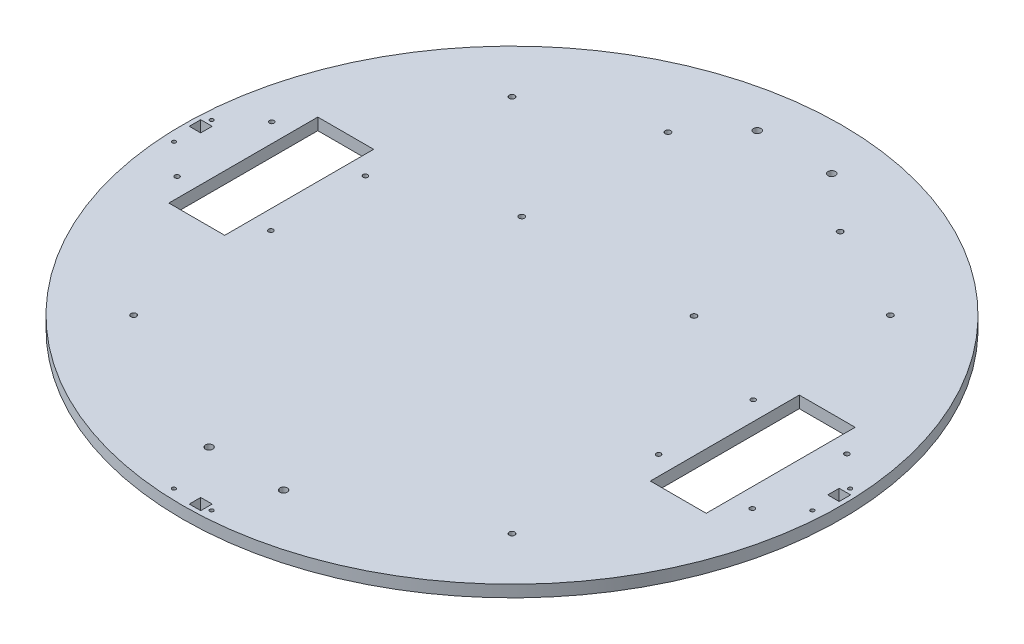
from build123d import *

# Parameters (mm, degrees)
SKETCH1_R           = 177
SKETCH1_R_2         = 1.27
SKETCH1_R_3         = 1.5
SKETCH1_R_4         = 2.000000064
SKETCH1_R_5         = 1
SKETCH1_W           = 6.15
SKETCH1_H           = 6.15
SKETCH1_W_2         = 30
SKETCH1_H_2         = 80
BOSS_EXTRUDE1_DEPTH = 6.35


with BuildPart() as part:
    # Sketch1 → Boss-Extrude1 (new body)
    with BuildSketch(Plane(origin=(0, 0, 0), x_dir=(1, 0, 0), z_dir=(0, 1, 0))):
        Circle(SKETCH1_R)
        with Locations((-154.46, 25.4)):
            Circle(SKETCH1_R_2, mode=Mode.SUBTRACT)
        with Locations((-154.46, -25.4)):
            Circle(SKETCH1_R_2, mode=Mode.SUBTRACT)
        with Locations((154.46, 25.4)):
            Circle(SKETCH1_R_2, mode=Mode.SUBTRACT)
        with Locations((154.46, -25.4)):
            Circle(SKETCH1_R_2, mode=Mode.SUBTRACT)
        with Locations((-104.14, 25.4)):
            Circle(SKETCH1_R_2, mode=Mode.SUBTRACT)
        with Locations((-104.14, -25.4)):
            Circle(SKETCH1_R_2, mode=Mode.SUBTRACT)
        with Locations((104.14, 25.4)):
            Circle(SKETCH1_R_2, mode=Mode.SUBTRACT)
        with Locations((104.14, -25.4)):
            Circle(SKETCH1_R_2, mode=Mode.SUBTRACT)
        with Locations((-43.25, 127)):
            Circle(SKETCH1_R_3, mode=Mode.SUBTRACT)
        with Locations((49.25, 127)):
            Circle(SKETCH1_R_3, mode=Mode.SUBTRACT)
        with Locations((-43.25, 48.5)):
            Circle(SKETCH1_R_3, mode=Mode.SUBTRACT)
        with Locations((49.25, 48.5)):
            Circle(SKETCH1_R_3, mode=Mode.SUBTRACT)
        with Locations((-101.6, -101.6)):
            Circle(SKETCH1_R_3, mode=Mode.SUBTRACT)
        with Locations((101.6, -101.6)):
            Circle(SKETCH1_R_3, mode=Mode.SUBTRACT)
        with Locations((-101.6, 101.6)):
            Circle(SKETCH1_R_3, mode=Mode.SUBTRACT)
        with Locations((101.6, 101.6)):
            Circle(SKETCH1_R_3, mode=Mode.SUBTRACT)
        with Locations((-20, -142.687006289)):
            Circle(SKETCH1_R_4, mode=Mode.SUBTRACT)
        with Locations((20, -142.687006289)):
            Circle(SKETCH1_R_4, mode=Mode.SUBTRACT)
        with Locations((-20, 151.719279026)):
            Circle(SKETCH1_R_4, mode=Mode.SUBTRACT)
        with Locations((20, 151.719279026)):
            Circle(SKETCH1_R_4, mode=Mode.SUBTRACT)
        with Locations((-10.125, -171.45)):
            Circle(SKETCH1_R_5, mode=Mode.SUBTRACT)
        with Locations((10.125, -171.45)):
            Circle(SKETCH1_R_5, mode=Mode.SUBTRACT)
        with Locations((171.45, -10.125)):
            Circle(SKETCH1_R_5, mode=Mode.SUBTRACT)
        with Locations((171.45, 10.125)):
            Circle(SKETCH1_R_5, mode=Mode.SUBTRACT)
        with Locations((-171.45, -10.125)):
            Circle(SKETCH1_R_5, mode=Mode.SUBTRACT)
        with Locations((-171.45, 10.125)):
            Circle(SKETCH1_R_5, mode=Mode.SUBTRACT)
        with Locations((171.45, 4.26)):
            Rectangle(SKETCH1_W, SKETCH1_H, mode=Mode.SUBTRACT)
        with Locations((-129.3, 0)):
            Rectangle(SKETCH1_W_2, SKETCH1_H_2, mode=Mode.SUBTRACT)
        with Locations((129.3, 0)):
            Rectangle(SKETCH1_W_2, SKETCH1_H_2, mode=Mode.SUBTRACT)
        with Locations((4.26, -171.45)):
            Rectangle(SKETCH1_W, SKETCH1_H, mode=Mode.SUBTRACT)
        with Locations((-171.45, 4.26)):
            Rectangle(SKETCH1_W, SKETCH1_H, mode=Mode.SUBTRACT)
    extrude(amount=BOSS_EXTRUDE1_DEPTH)


solid = part.part
